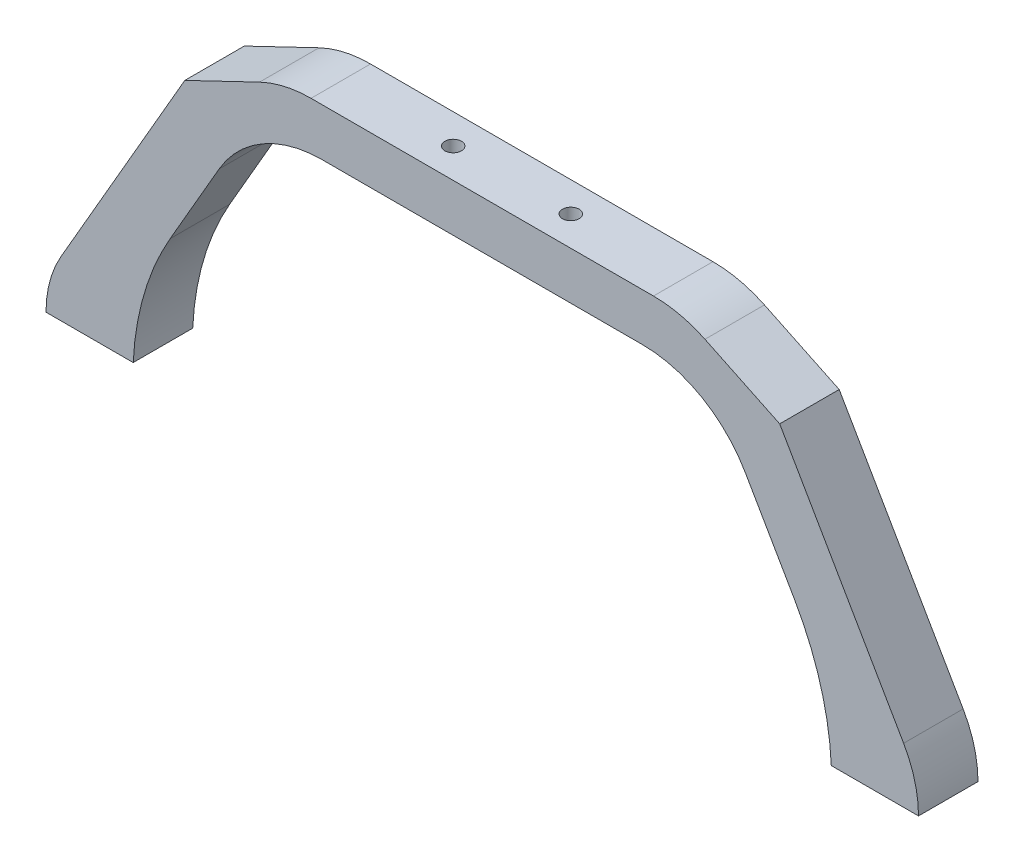
from build123d import *

# Parameters (mm, degrees)
BOSS_EXTRUDE1_DEPTH = 7.5
CUT_EXTRUDE1_START  = 80.121778
SKETCH3_R           = 2.1
CUT_EXTRUDE1_DEPTH  = 12
FILLET1_R           = 30
FILLET1_R_2         = 70
FILLET2_R           = 30
FILLET2_R_2         = 28
CUT_EXTRUDE2_START  = 72.121778
SKETCH3_4_R         = 4.5
SKETCH3_4_R_2       = 2.1
CUT_EXTRUDE2_DEPTH  = 6


with BuildPart() as part:
    # Sketch2 → Boss-Extrude1 (new, symmetric)
    with BuildSketch(Plane.XY):
        Polygon((-50, 80.121778265), (-75, 68.121778265), (-110, 7.5), (-110, 0), (-88.009618943, 0), (-88.009618943, 15.588457268), (-57.679491924, 68.121778265), (57.679491924, 68.121778265), (88.009618943, 15.588457268), (88.009618943, 0), (110, 0), (110, 7.5), (75, 68.121778265), (50, 80.121778265), align=None)
    extrude(amount=BOSS_EXTRUDE1_DEPTH, both=True)

    # Sketch3 → Cut-Extrude1 (cut)
    with BuildSketch(Plane(origin=(0, 0, 0), x_dir=(1, 0, 0), z_dir=(0, 1, 0)).offset(CUT_EXTRUDE1_START)):
        with Locations(Location((-14.832079928, 0, 0), (0, 0, 270))):
            Circle(SKETCH3_R)
        with Locations(Location((14.832079928, 0, 0), (0, 0, 270))):
            Circle(SKETCH3_R)
    extrude(amount=-CUT_EXTRUDE1_DEPTH, mode=Mode.SUBTRACT)

    # Fillet1
    # the kernel refuses this fillet: 70, 30 mm, written as the material it adds along each edge
    with BuildSketch(Plane(origin=(-57.679491924, 68.121778265, -7.5), x_dir=(-0.500000000000001, -0.8660254037844382, 0), z_dir=(0, 0, 1)), Plane(origin=(57.679491924, 68.121778265, -7.5), x_dir=(-1, 0, 0), z_dir=(0, 0, 1))) as fillet1_piece_1:
        with BuildLine():
            CenterArc((FILLET1_R * 0.57735026919, FILLET1_R), FILLET1_R, 210, 60)
            Line((-FILLET1_R * 0.288675134595, FILLET1_R * 0.5), (-FILLET1_R * 0.305995642671, FILLET1_R * 0.49))
            Line((-FILLET1_R * 0.305995642671, FILLET1_R * 0.49), (-FILLET1_R * 0.0115470053838, -FILLET1_R * 0.02))
            Line((-FILLET1_R * 0.0115470053838, -FILLET1_R * 0.02), (FILLET1_R * 0.57735026919, -FILLET1_R * 0.02))
            Line((FILLET1_R * 0.57735026919, -FILLET1_R * 0.02), (FILLET1_R * 0.57735026919, 0))
        make_face()
    extrude(amount=15)
    with BuildSketch(Plane(origin=(-88.009618943, 15.588457268, -7.5), x_dir=(0, -1, 0), z_dir=(0, 0, 1))) as fillet1_piece_2:
        with BuildLine():
            CenterArc((18.891495711, 69.922027552), FILLET1_R_2, 240, 27.295421975)
            Line((-16.108504289, 9.300249288), (-16.808504289, 8.087813722))
            Line((-16.808504289, 8.087813722), (-0.7, -1.212435565))
            Line((-0.7, -1.212435565), (0, -1.4))
            ThreePointArc((0, -1.4), (7.794228634, -1.4), (15.522396499, -1.398440551))
            Line((15.522396499, -1.398440551), (15.588457268, 0))
        make_face()
    extrude(amount=15)
    with BuildSketch(Plane(origin=(88.009618943, 15.588457268, 7.5), x_dir=(-0.5000000000000018, 0.8660254037844377, 0), z_dir=(0, 0, -1))) as fillet1_piece_3:
        with BuildLine():
            CenterArc((18.600498575, -70), FILLET1_R_2, 90, 27.295421975)
            Line((-13.5, -7.794228634), (-14.142009972, -6.550113207))
            ThreePointArc((-14.142009972, -6.550113207), (-7.45, -2.684678752), (-0.7, 1.212435565))
            Line((-0.7, 1.212435565), (0, 1.4))
            Line((0, 1.4), (18.600498575, 1.4))
            Line((18.600498575, 1.4), (18.600498575, 0))
        make_face()
    extrude(amount=15)

    # Fillet2
    # the kernel refuses this fillet: 30, 28 mm, written as the material it takes off along each edge
    with BuildSketch(Plane(origin=(-50, 80.121778265, -24.567807798), x_dir=(1, 0, 0), z_dir=(0, 0, 1)), Plane(origin=(50, 80.121778265, -24.567807798), x_dir=(0.9015230574682733, -0.43273106758477164, 0), z_dir=(0, 0, 1))) as fillet2_piece_1:
        with BuildLine():
            CenterArc((FILLET2_R * 0.227570770644, -FILLET2_R), FILLET2_R, 90, 25.641005824)
            Line((-FILLET2_R * 0.205160296941, -FILLET2_R * 0.0984769425317), (0, 0))
            Line((0, 0), (FILLET2_R * 0.227570770644, 0))
        make_face()
    extrude(amount=49.135615597, mode=Mode.SUBTRACT)
    with BuildSketch(Plane(origin=(-110, 7.5, -26.25644347), x_dir=(0.5000000000000017, 0.8660254037844376, 0), z_dir=(0, 0, 1)), Plane(origin=(110, 7.5, -26.25644347), x_dir=(0, -1, 0), z_dir=(0, 0, 1))) as fillet2_piece_2:
        with BuildLine():
            CenterArc((FILLET2_R_2 * 0.267949192431, -FILLET2_R_2), FILLET2_R_2, 90, 30)
            Line((-FILLET2_R_2 * 0.232050807569, -FILLET2_R_2 * 0.133974596216), (0, 0))
            Line((0, 0), (FILLET2_R_2 * 0.267949192431, 0))
        make_face()
    extrude(amount=52.51288694, mode=Mode.SUBTRACT)

    # Sketch3<4> → Cut-Extrude2 (cut)
    # profile 1 of 2: a face of its own
    with BuildSketch(Plane(origin=(0, 0, 0), x_dir=(1, 0, 0), z_dir=(0, 1, 0)).offset(CUT_EXTRUDE2_START)):
        with Locations(Location((-14.832079928, 0, 0), (0, 0, 90))):
            Circle(SKETCH3_4_R)
        with Locations(Location((-14.832079928, 0, 0), (0, 0, 270))):
            Circle(SKETCH3_4_R_2, mode=Mode.SUBTRACT)
    # profile 2 of 2: a face of its own
    with BuildSketch(Plane(origin=(0, 0, 0), x_dir=(1, 0, 0), z_dir=(0, 1, 0)).offset(CUT_EXTRUDE2_START)):
        with Locations(Location((14.832079928, 0, 0), (0, 0, 90))):
            Circle(SKETCH3_4_R)
        with Locations(Location((14.832079928, 0, 0), (0, 0, 270))):
            Circle(SKETCH3_4_R_2, mode=Mode.SUBTRACT)
    extrude(amount=-CUT_EXTRUDE2_DEPTH, mode=Mode.SUBTRACT)


solid = part.part
